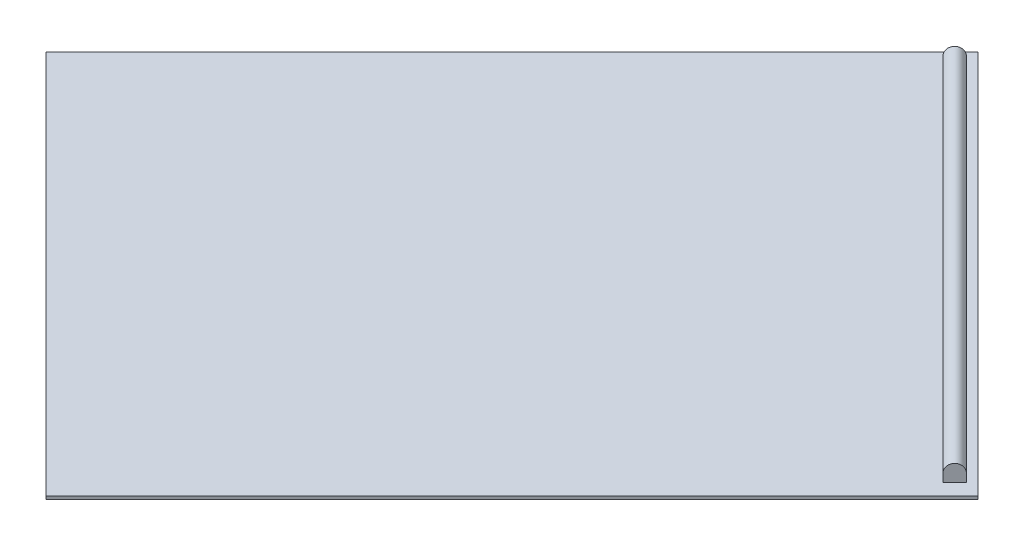
from build123d import *

# Parameters (mm, degrees)
BOSS_EXTRUDE1_DEPTH = 2
BOSS_EXTRUDE2_DEPTH = 10
CUT_EXTRUDE1_REACH  = 587.998


with BuildPart() as part:
    # Sketch1 → Boss-Extrude1 (new body)
    with BuildSketch(Plane(origin=(0, 0, 0), x_dir=(1, 0, 0), z_dir=(0, 1, 0))):
        Polygon((-49.497474683, -516.187950266), (233.345237792, -233.345237792), (0, 0), (-282.842712475, -282.842712475), align=None)
    extrude(amount=BOSS_EXTRUDE1_DEPTH)

    # Sketch4 → Boss-Extrude2 (add)
    with BuildSketch(Plane(origin=(0, 2, 0), x_dir=(1, 0, 0), z_dir=(0, 1, 0))):
        Polygon((3.535533906, -10.606601718), (-3.535533906, -17.67766953), (215.667568262, -236.880771697), (222.738636074, -229.809703886), align=None)
    extrude(amount=BOSS_EXTRUDE2_DEPTH)

    # Sketch6 → Cut-Extrude1 (cut, up to next)
    with BuildSketch(Plane(origin=(7.071067812, 0, 7.071067812), x_dir=(-0.707106781186548, 0, 0.7071067811865471), z_dir=(-0.7071067811865471, 0, -0.707106781186548)), mode=Mode.PRIVATE) as cut_extrude1_sk1:
        with BuildLine():
            Line((15, 12), (10, 12))
            ThreePointArc((10, 12), (13.535533906, 10.535533906), (15, 7))
            Line((15, 7), (15, 12))
        make_face()
    cut_extrude1_tool1 = extrude(cut_extrude1_sk1.sketch, amount=-CUT_EXTRUDE1_REACH, mode=Mode.PRIVATE) & part.part
    # Sketch6 → Cut-Extrude1 (cut, up to next)
    with BuildSketch(Plane(origin=(7.071067812, 0, 7.071067812), x_dir=(-0.707106781186548, 0, 0.7071067811865471), z_dir=(-0.7071067811865471, 0, -0.707106781186548)), mode=Mode.PRIVATE) as cut_extrude1_sk2:
        with BuildLine():
            Line((5, 12), (5, 7))
            ThreePointArc((5, 7), (6.464466094, 10.535533906), (10, 12))
            Line((10, 12), (5, 12))
        make_face()
    cut_extrude1_tool2 = extrude(cut_extrude1_sk2.sketch, amount=-CUT_EXTRUDE1_REACH, mode=Mode.PRIVATE) & part.part
    add(cut_extrude1_tool1.solids().sort_by_distance((-2.745809, 10.88316, 16.887945))[0], mode=Mode.SUBTRACT)
    add(cut_extrude1_tool2.solids().sort_by_distance((2.745809, 10.88316, 11.396327))[0], mode=Mode.SUBTRACT)


solid = part.part
